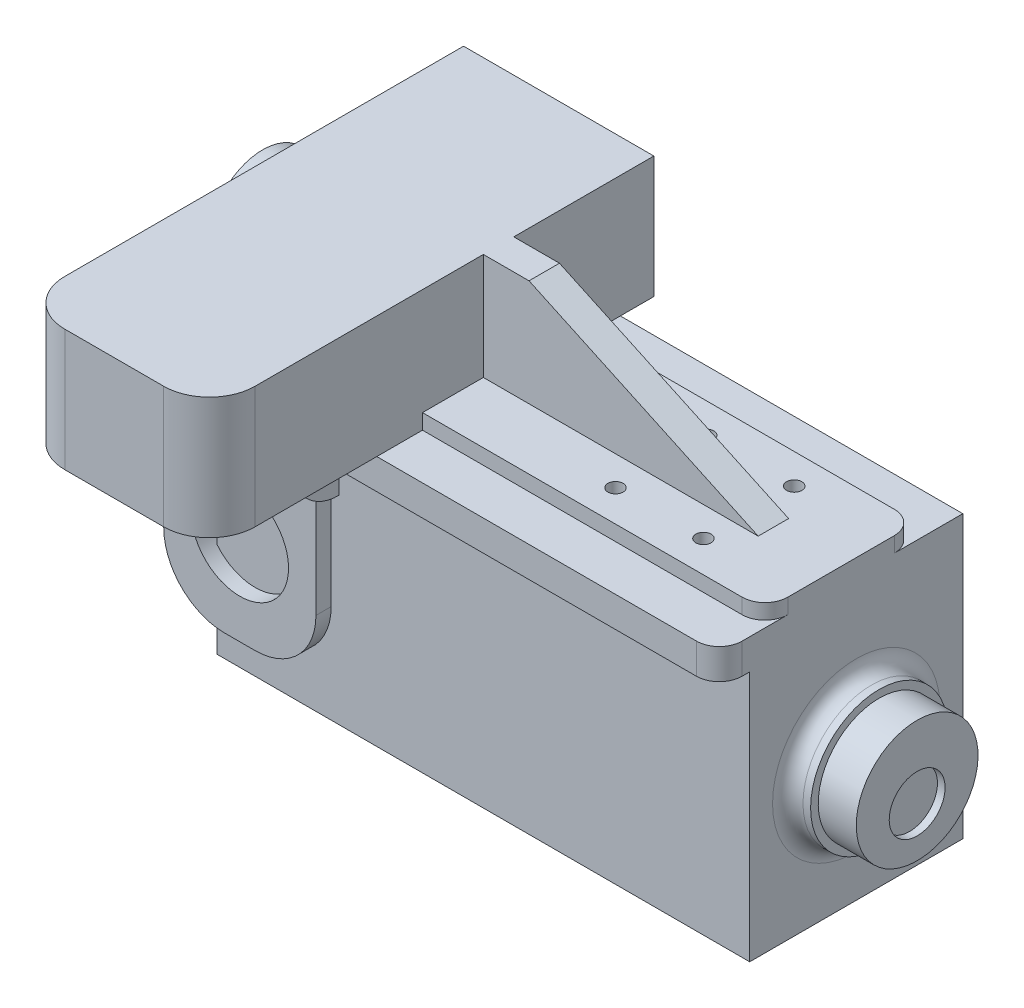
from build123d import *

# Parameters (mm, degrees)
BOSS_EXTRUDE1_DEPTH       = 150
BOSS_EXTRUDE1_DEPTH_BACK  = 100
SKETCH1_W                 = 250
SKETCH1_H                 = 230
SKETCH2_W                 = 200
SKETCH2_H                 = 30
BOSS_EXTRUDE2_DEPTH       = 150
BOSS_EXTRUDE3_DEPTH       = 120
BOSS_EXTRUDE3_DEPTH_BACK  = 20
SKETCH4_W                 = 350
SKETCH4_H                 = 165
RIB1_REACH                = 447.477
SKETCH5_WALL_W            = 1072.6047598
SKETCH5_WALL_H            = 250
SKETCH6_R                 = 45
BOSS_EXTRUDE4_DEPTH       = 15
SKETCH7_R                 = 40
BOSS_EXTRUDE5_DEPTH       = 20
SKETCH8_W                 = 100
SKETCH8_H                 = 100
SKETCH10_W                = 20
SKETCH10_H                = 100
BOSS_EXTRUDE6_DEPTH       = 150
RIB2_REACH                = 449.985
SKETCH12_WALL_W           = 999.204922194
SKETCH12_WALL_H           = 20
SKETCH13_R                = 32
CUT_EXTRUDE1_DEPTH        = 10
FILLET1_R                 = 50
FILLET2_R                 = 30
FILLET3_R                 = 15
FILLET4_R                 = 15
SKETCH14_R                = 40
SKETCH14_R_2              = 18.360426304
BOSS_EXTRUDE7_DEPTH       = 5
FILLET6_R                 = 10
SKETCH15_W                = 250
SKETCH15_H                = 230
SKETCH15_W_2              = 170
SKETCH15_H_2              = 165.671954638
CUT_EXTRUDE2_DEPTH        = 40
SKETCH16_R                = 50
SKETCH16_R_2              = 30
BOSS_EXTRUDE8_DEPTH       = 30
SKETCH16_2_R              = 30
BOSS_EXTRUDE9_DEPTH       = 50
SKETCH17_W                = 787.442297404
SKETCH17_H                = 468.570764298
CUT_EXTRUDE3_DEPTH        = 459.262102583
SKETCH18_W                = 754.820557273
SKETCH18_H                = 297.051261894
CUT_EXTRUDE4_DEPTH        = 391.736484091
BOSS_EXTRUDE10_DEPTH      = 30
BOSS_EXTRUDE11_DEPTH      = 20
BOSS_EXTRUDE12_DEPTH      = 100
BOSS_EXTRUDE12_DEPTH_BACK = 192
SKETCH23_W                = 125
SKETCH23_H                = 80
SKETCH26_W                = 38.43559463
SKETCH26_H                = 130.536564267
CUT_EXTRUDE8_DEPTH        = 196
SKETCH27_W                = 225
SKETCH27_H                = 100
BOSS_EXTRUDE14_DEPTH      = 10
BOSS_EXTRUDE15_DEPTH      = 10
BOSS_EXTRUDE15_DEPTH_BACK = 10
SKETCH29_R                = 35
BOSS_EXTRUDE16_DEPTH      = 20
FILLET7_R                 = 15
FILLET9_R                 = 15
SKETCH33_R                = 40
BOSS_EXTRUDE17_DEPTH      = 20
SKETCH31_R                = 5
CUT_EXTRUDE10_DEPTH       = 10
BOSS_EXTRUDE18_DEPTH      = 10
BOSS_EXTRUDE18_DEPTH_BACK = 20
SKETCH20_R                = 32
FILLET10_R                = 30
SCALE1_SCALE              = 0.6


with BuildPart() as part:
    # Sketch1 → Boss-Extrude1 (new, two sides: drawn at the far end of the back side and taken through both)
    with BuildSketch(Plane(origin=(0, 0, 0), x_dir=(1, 0, 0), z_dir=(0, 1, 0)).offset(-BOSS_EXTRUDE1_DEPTH_BACK)):
        Rectangle(SKETCH1_W, SKETCH1_H)
    extrude(amount=BOSS_EXTRUDE1_DEPTH + BOSS_EXTRUDE1_DEPTH_BACK)

    # Sketch2 → Boss-Extrude2 (add)
    with BuildSketch(Plane(origin=(125, 0, 0), x_dir=(0, 0, -1), z_dir=(1, 0, 0))):
        with Locations((0, -15)):
            Rectangle(SKETCH2_W, SKETCH2_H)
    extrude(amount=BOSS_EXTRUDE2_DEPTH)

    # Sketch4 → Boss-Extrude3 (add, two sides: drawn at the far end of the back side and taken through both)
    with BuildSketch(Plane(origin=(0, 0, -115), x_dir=(-1, 0, 0), z_dir=(0, 0, -1)).offset(-BOSS_EXTRUDE3_DEPTH_BACK)):
        with Locations((-50, 177.5)):
            Rectangle(SKETCH4_W, SKETCH4_H)
    extrude(amount=BOSS_EXTRUDE3_DEPTH + BOSS_EXTRUDE3_DEPTH_BACK)

    # Sketch5 wall → Rib1 (add, up to next)
    with BuildSketch(Plane(origin=(0, 205, -23.982044646), x_dir=(0, 0.612300963241, -0.790624772199), z_dir=(0, 0.790624772199, 0.612300963241)), mode=Mode.PRIVATE) as rib1_sk1:
        Rectangle(SKETCH5_WALL_W, SKETCH5_WALL_H)
    rib1_tool1 = extrude(rib1_sk1.sketch, amount=-RIB1_REACH, mode=Mode.PRIVATE) - part.part
    add(rib1_tool1.solids().sort_by_distance((0, 205, -23.982044646))[0])

    # Sketch6 → Boss-Extrude4 (add)
    with BuildSketch(Plane(origin=(225, 0, 0), x_dir=(0, 0, -1), z_dir=(1, 0, 0))):
        with Locations(Location((165, 177.5, 0), (0, 0, 90))):
            Circle(SKETCH6_R)
    extrude(amount=BOSS_EXTRUDE4_DEPTH)

    # Sketch7 → Boss-Extrude5 (add)
    with BuildSketch(Plane(origin=(240, 0, 0), x_dir=(0, 0, -1), z_dir=(1, 0, 0))):
        with Locations(Location((165, 177.5, 0), (0, 0, 90))):
            Circle(SKETCH7_R)
    extrude(amount=BOSS_EXTRUDE5_DEPTH)

    # Sweep1: sweep along a path in Sketch9
    with BuildLine(Plane(origin=(0, 0, 0), x_dir=(0, 0, -1), z_dir=(1, 0, 0))) as sweep1_path:
        ThreePointArc((23.982044646, 205), (3.428361586, 247.544867247), (-5.288861265, 293.983317287))
    # Sketch8 → Sweep1 (sweep)
    with BuildSketch(Plane(origin=(0, 116.533228497, 90.24939588), x_dir=(1, 0, 0), z_dir=(0, 0.7906247721978943, 0.6123009632419566))):
        with Locations((0, 144.482496049)):
            Rectangle(SKETCH8_W, SKETCH8_H)
    sweep(path=sweep1_path.line)

    # Sketch10 → Boss-Extrude6 (add)
    with BuildSketch(Plane(origin=(125, 0, 0), x_dir=(0, 0, -1), z_dir=(1, 0, 0))):
        with Locations((85, 164.273096985)):
            Rectangle(SKETCH10_W, SKETCH10_H)
    extrude(amount=BOSS_EXTRUDE6_DEPTH)

    # Sketch12 wall → Rib2 (add, up to next)
    with BuildSketch(Plane(origin=(160.792179202, 164.273096985, -35.792179202), x_dir=(0.707106781187, 0, -0.707106781187), z_dir=(0.707106781187, 0, 0.707106781187)), mode=Mode.PRIVATE) as rib2_sk1:
        Rectangle(SKETCH12_WALL_W, SKETCH12_WALL_H)
    rib2_tool1 = extrude(rib2_sk1.sketch, amount=-RIB2_REACH, mode=Mode.PRIVATE) - part.part
    add(rib2_tool1.solids().sort_by_distance((160.792179202, 164.273096985, -35.792179202))[0])

    # Sketch13 → Cut-Extrude1 (cut)
    with BuildSketch(Plane.XZ.offset(30)):
        with Locations(Location((218.869669038, 0, 0), (0, 0, 270))):
            Circle(SKETCH13_R)
    extrude(amount=-CUT_EXTRUDE1_DEPTH, mode=Mode.SUBTRACT)

    # Fillet1
    fillet1_edges = [part.edges().sort_by_distance(p)[0] for p in [
        (275, -15, 100),
        (275, -15, -100),
    ]]
    fillet(fillet1_edges, radius=FILLET1_R)

    # Fillet2
    fillet2_edges = [part.edges().sort_by_distance(p)[0] for p in [
        (125, 95, -105),
    ]]
    fillet(fillet2_edges, radius=FILLET2_R)

    # Fillet3
    fillet3_edges = [part.edges().sort_by_distance(p)[0] for p in [
        (125, 214.273096985, -85),
        (125, 114.273096985, -85),
    ]]
    fillet(fillet3_edges, radius=FILLET3_R)

    # Fillet4
    fillet4_edges = [part.edges().sort_by_distance(p)[0] for p in [
        (50, 205, -23.982044646),
        (0, 235.615048162, -63.513283256),
        (-50, 205, -23.982044646),
        (0, 174.384951838, 15.549193964),
    ]]
    fillet(fillet4_edges, radius=FILLET4_R)

    # Sketch14 → Boss-Extrude7 (add)
    with BuildSketch(Plane(origin=(260, 0, 0), x_dir=(0, 0, -1), z_dir=(1, 0, 0))):
        with Locations(Location((165, 177.5, 0), (0, 0, 90))):
            Circle(SKETCH14_R)
        with Locations(Location((165, 170, 0), (0, 0, 90))):
            Circle(SKETCH14_R_2, mode=Mode.SUBTRACT)
    extrude(amount=BOSS_EXTRUDE7_DEPTH)

    # Fillet6
    fillet6_edges = [part.edges().sort_by_distance(p)[0] for p in [
        (225, 132.5, -165),
    ]]
    fillet(fillet6_edges, radius=FILLET6_R)

    # Sketch15 → Cut-Extrude2 (cut)
    with BuildSketch(Plane.XZ.offset(100)):
        Rectangle(SKETCH15_W, SKETCH15_H)
        Rectangle(SKETCH15_W_2, SKETCH15_H_2, mode=Mode.SUBTRACT)
    extrude(amount=-CUT_EXTRUDE2_DEPTH, mode=Mode.SUBTRACT)

    # Sketch16 → Boss-Extrude8 (add)
    with BuildSketch(Plane.ZY.offset(125)):
        with Locations((0, 30)):
            Circle(SKETCH16_R)
        with Locations((0, 30)):
            Circle(SKETCH16_R_2, mode=Mode.SUBTRACT)
    extrude(amount=BOSS_EXTRUDE8_DEPTH)

    # Sketch16<2> → Boss-Extrude9 (add)
    with BuildSketch(Plane.ZY.offset(125)):
        with Locations((0, 30)):
            Circle(SKETCH16_2_R)
    extrude(amount=BOSS_EXTRUDE9_DEPTH)

    # Sketch17 → Cut-Extrude3 (cut, through all)
    with BuildSketch(Plane.XY.offset(-95)):
        with Locations((43.842387257, 99.928182048)):
            Rectangle(SKETCH17_W, SKETCH17_H)
    extrude(amount=CUT_EXTRUDE3_DEPTH, mode=Mode.SUBTRACT)

    # Sketch18 → Cut-Extrude4 (cut, through all)
    with BuildSketch(Plane.XZ.offset(-95)):
        with Locations((103.1212944, -159.735098903)):
            Rectangle(SKETCH18_W, SKETCH18_H)
    extrude(amount=CUT_EXTRUDE4_DEPTH, mode=Mode.SUBTRACT)

    # Sketch19 → Boss-Extrude10 (add)
    with BuildSketch(Plane(origin=(0, 0, -95), x_dir=(-1, 0, 0), z_dir=(0, 0, -1))):
        Polygon((125, 260), (44.807978096, 260), (44.807978096, 161.220017504), (100, 95), (125, 177.5), align=None)
    extrude(amount=-BOSS_EXTRUDE10_DEPTH)

    # Sketch22 → Boss-Extrude11 (add)
    with BuildSketch(Plane(origin=(0, 260, 0), x_dir=(1, 0, 0), z_dir=(0, 1, 0))):
        Polygon((225, 95), (225, 75), (-44.807978096, 75), (-44.807978096, 65), (-125, 65), (-125, 235), (225, 235), align=None)
    extrude(amount=BOSS_EXTRUDE11_DEPTH)

    # Sketch23 → Boss-Extrude12 (add, two sides: drawn at the far end of the back side and taken through both)
    with BuildSketch(Plane.XY.offset(-65).offset(-BOSS_EXTRUDE12_DEPTH_BACK)):
        with Locations((-62.5, 320)):
            Rectangle(SKETCH23_W, SKETCH23_H)
    extrude(amount=BOSS_EXTRUDE12_DEPTH + BOSS_EXTRUDE12_DEPTH_BACK)

    # Sketch26 → Cut-Extrude8 (cut)
    with BuildSketch(Plane(origin=(-44.807978096, 0, 0), x_dir=(0, 0, -1), z_dir=(1, 0, 0))):
        with Locations((75.782202685, 160.268282134)):
            Rectangle(SKETCH26_W, SKETCH26_H)
    extrude(amount=-CUT_EXTRUDE8_DEPTH, mode=Mode.SUBTRACT)

    # Sketch27 → Boss-Extrude14 (add)
    with BuildSketch(Plane(origin=(0, 280, 0), x_dir=(1, 0, 0), z_dir=(0, 1, 0))):
        with Locations((112.5, 155)):
            Rectangle(SKETCH27_W, SKETCH27_H)
    extrude(amount=BOSS_EXTRUDE14_DEPTH)

    # Sketch28 → Boss-Extrude15 (add, two sides: drawn at the far end of the back side and taken through both)
    with BuildSketch(Plane.XY.offset(-155).offset(-BOSS_EXTRUDE15_DEPTH_BACK)):
        Polygon((0, 360), (0, 290), (180.556109721, 290), (30, 360), align=None)
    extrude(amount=BOSS_EXTRUDE15_DEPTH + BOSS_EXTRUDE15_DEPTH_BACK)

    # Sketch29 → Boss-Extrude16 (add)
    with BuildSketch(Plane.ZY.offset(125)):
        with Locations((-145, 312.056134744)):
            Circle(SKETCH29_R)
    extrude(amount=BOSS_EXTRUDE16_DEPTH)

    # Fillet7
    fillet7_edges = [part.edges().sort_by_distance(p)[0] for p in [
        (225, 270, -75),
    ]]
    fillet(fillet7_edges, radius=FILLET7_R)

    # Fillet9
    fillet9_edges = [part.edges().sort_by_distance(p)[0] for p in [
        (225, 285, -205),
        (225, 285, -105),
    ]]
    fillet(fillet9_edges, radius=FILLET9_R)

    # Sketch33 → Boss-Extrude17 (add)
    with BuildSketch(Plane(origin=(0, 0, -235), x_dir=(-1, 0, 0), z_dir=(0, 0, -1))):
        with Locations(Location((-145, 180, 0), (0, 0, 180))):
            Circle(SKETCH33_R)
    extrude(amount=BOSS_EXTRUDE17_DEPTH)

    # Sketch31 → Cut-Extrude10 (cut)
    with BuildSketch(Plane(origin=(0, 290, 0), x_dir=(1, 0, 0), z_dir=(0, 1, 0))):
        with Locations(Location((106.129760479, 125.68527506, 0), (0, 0, 180))):
            Circle(SKETCH31_R)
        with Locations(Location((163.912196034, 125.68527506, 0), (0, 0, 180))):
            Circle(SKETCH31_R)
        with Locations((230.176456992, 125.68527506)):
            Circle(SKETCH31_R)
        with Locations(Location((163.912196034, 185.323109922, 0), (0, 0, 180))):
            Circle(SKETCH31_R)
        with Locations(Location((106.129760479, 185.323109922, 0), (0, 0, 180))):
            Circle(SKETCH31_R)
        with Locations((230.176456992, 185.323109922)):
            Circle(SKETCH31_R)
    extrude(amount=-CUT_EXTRUDE10_DEPTH, mode=Mode.SUBTRACT)

    # Sketch20 → Boss-Extrude18 (add, two sides: drawn at the far end of the back side and taken through both)
    with BuildSketch(Plane.XY.offset(-95).offset(-BOSS_EXTRUDE18_DEPTH_BACK)):
        with BuildLine():
            Line((-50, 260), (-50, 159.605646018))
            ThreePointArc((-50, 159.605646018), (-61.715728753, 131.321374771), (-90, 119.605646018))
            Line((-90, 119.605646018), (-110, 119.605646018))
            ThreePointArc((-110, 119.605646018), (-138.284271247, 131.321374771), (-150, 159.605646018))
            Line((-150, 159.605646018), (-150, 260))
            Line((-150, 260), (-50, 260))
        make_face()
        with Locations((-100, 177.5)):
            Circle(SKETCH20_R, mode=Mode.SUBTRACT)
    extrude(amount=BOSS_EXTRUDE18_DEPTH + BOSS_EXTRUDE18_DEPTH_BACK)

    # Fillet10
    fillet10_edges = [part.edges().sort_by_distance(p)[0] for p in [
        (-84.903989048, 225.536564267, -65),
        (-125, 320, 35),
        (0, 320, 35),
    ]]
    fillet(fillet10_edges, radius=FILLET10_R - 0.0001)  # a hair under: the kernel refuses the full size


with BuildPart() as part_1:
    # Scale1: scaled about (26.616775413, 221.668719116, -151.512951555)
    add(part.part.scale(SCALE1_SCALE).moved(Location((10.646710165, 88.667487646, -60.605180622))))


solid = part_1.part
